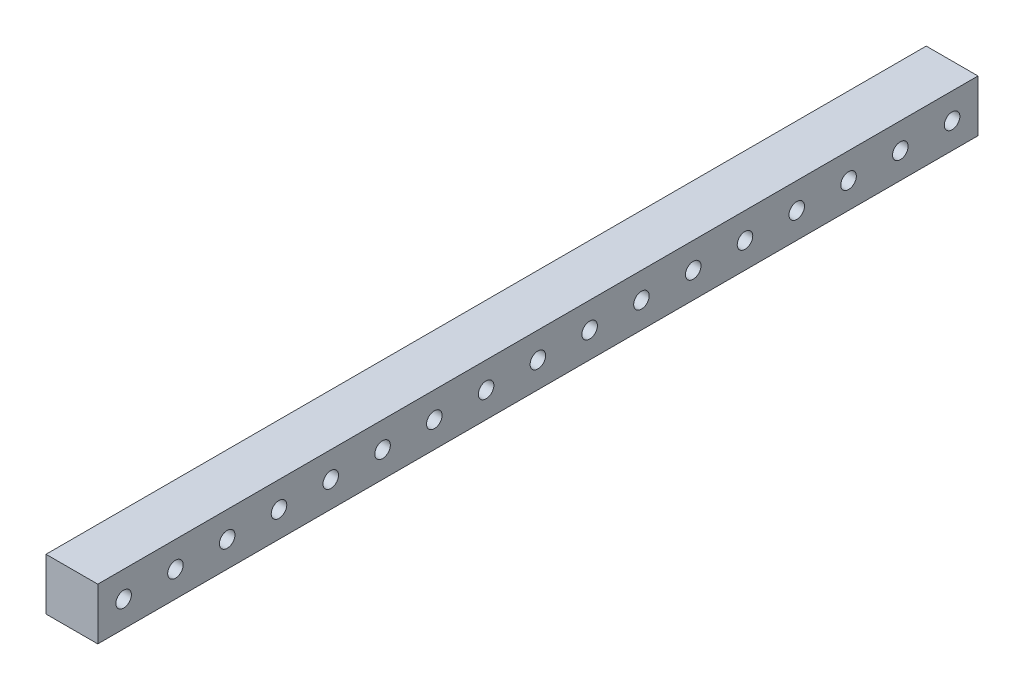
from build123d import *

# Parameters (mm, degrees)
SKETCH1_W             = 20
SKETCH1_H             = 20
BOSS_EXTRUDE1_DEPTH   = 340
F_6_0MM_DOWEL_HOLE1_D = 6
LPATTERN2_COUNT       = 17
LPATTERN2_PITCH       = 20


with BuildPart() as part:
    # Sketch1 → Boss-Extrude1 (new body)
    with BuildSketch(Plane.XY):
        Rectangle(SKETCH1_W, SKETCH1_H)
    extrude(amount=BOSS_EXTRUDE1_DEPTH)

    # Ø6.0mm Dowel Hole1 (through all)
    with Locations(Plane(origin=(10, 0, 0), x_dir=(0, 0, -1), z_dir=(1, 0, 0))):
        with Locations((-10, 0)):
            f_6_0mm_dowel_hole1 = Hole(F_6_0MM_DOWEL_HOLE1_D / 2)

    # LPattern2: Ø6.0mm Dowel Hole1 ×17
    with Locations(*[(0, 0, i * LPATTERN2_PITCH) for i in range(1, LPATTERN2_COUNT)]):
        add(f_6_0mm_dowel_hole1, mode=Mode.SUBTRACT)


solid = part.part
